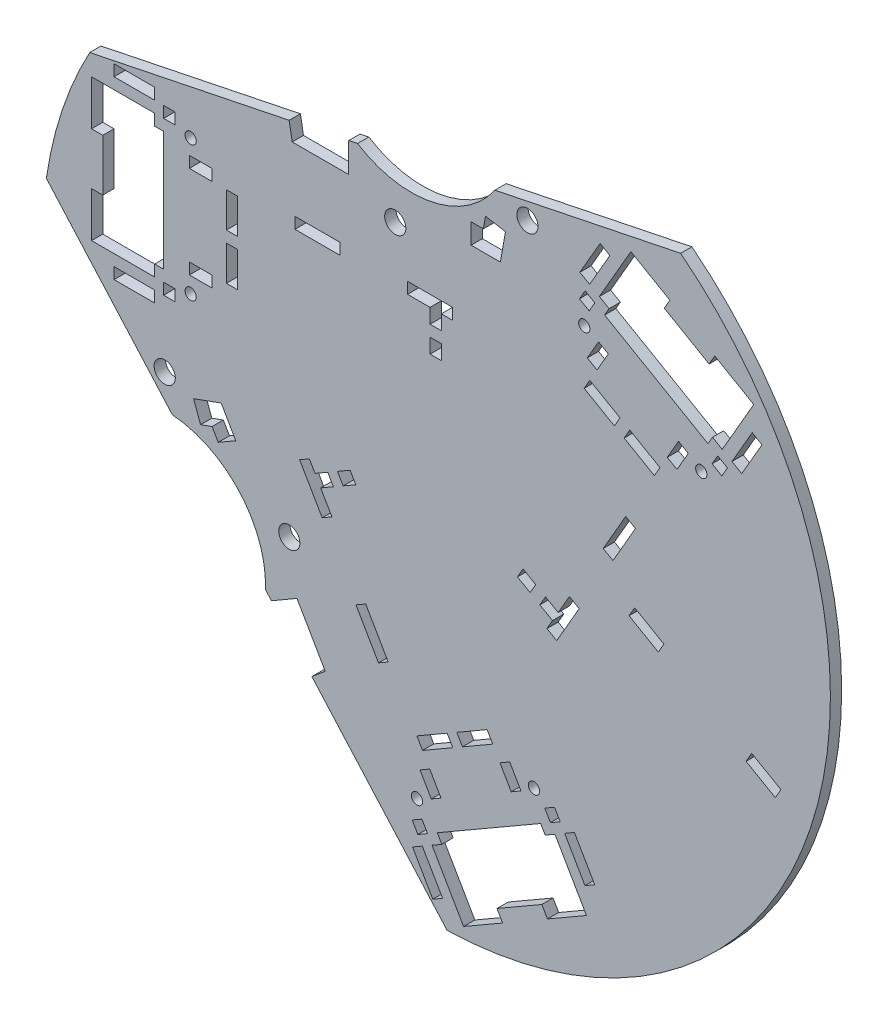
from build123d import *

# Parameters (mm, degrees)
ESQUISSE1_R             = 175
BOSS_EXTRU_1_DEPTH      = 5
ESQUISSE2_W             = 5
ESQUISSE2_H             = 6.5
ESQUISSE2_W_2           = 20
ESQUISSE2_H_2           = 5
ESQUISSE2_H_3           = 15.5
ESQUISSE2_W_3           = 10
ESQUISSE2_W_4           = 18
ESQUISSE2_H_4           = 20
ENL_V_MAT_EXTRU_1_DEPTH = 5
ENL_V_MAT_EXTRU_2_DEPTH = 5
ESQUISSE4_R             = 2.5
ENL_V_MAT_EXTRU_3_DEPTH = 5
ESQUISSE5_R             = 4.7
ENL_V_MAT_EXTRU_4_DEPTH = 5
BOSS_EXTRU_2_DEPTH      = 5
ENL_V_MAT_EXTRU_5_DEPTH = 5


with BuildPart() as part:
    # Esquisse1 → Boss.-Extru.1 (new body)
    with BuildSketch(Plane.XY):
        with Locations((148.080426897, -12.110171348)):
            Circle(ESQUISSE1_R)
    extrude(amount=BOSS_EXTRU_1_DEPTH)

    # Esquisse2 → Enlèv. mat.-Extru.1 (cut)
    with BuildSketch(Plane(origin=(0, 0, 0), x_dir=(-1, 0, 0), z_dir=(0, 0, -1))):
        Polygon((-155.311788567, 53.777441362), (-135.311788567, 53.777441362), (-135.311788567, 48.777441362), (-145.311788567, 48.777441362), (-145.311788567, 42.277441362), (-150.311788567, 42.277441362), (-150.311788567, 48.777441362), (-155.311788567, 48.777441362), align=None)
        with Locations((-147.811788567, 34.027441362)):
            Rectangle(ESQUISSE2_W, ESQUISSE2_H)
        with Locations((-95.311788567, 51.277441362)):
            Rectangle(ESQUISSE2_W_2, ESQUISSE2_H_2)
        with Locations((-57.36, 41.027441362)):
            Rectangle(ESQUISSE2_W, ESQUISSE2_H_3)
        with Locations((-57.36, 20.527441362)):
            Rectangle(ESQUISSE2_W, ESQUISSE2_H_3)
        with Locations((-43.43, 10.277441362)):
            Rectangle(ESQUISSE2_W_3, ESQUISSE2_H_2)
        with Locations((-29.5, -3.222558638)):
            Rectangle(ESQUISSE2_W, ESQUISSE2_H_2)
        with Locations((-14, -8.222558638)):
            Rectangle(ESQUISSE2_W_4, ESQUISSE2_H_2)
        with Locations((2.5, 9.277441362)):
            Rectangle(ESQUISSE2_W, ESQUISSE2_H_4)
        with Locations((2.5, 52.277441362)):
            Rectangle(ESQUISSE2_W, ESQUISSE2_H_4)
        with Locations((-14, 69.777441362)):
            Rectangle(ESQUISSE2_W_4, ESQUISSE2_H_2)
        with Locations((-29.5, 64.777441362)):
            Rectangle(ESQUISSE2_W, ESQUISSE2_H_2)
        with Locations((-43.43, 51.277441362)):
            Rectangle(ESQUISSE2_W_3, ESQUISSE2_H_2)
        Polygon((-87.404399659, -38.791434793), (-97.404399659, -56.111942869), (-101.734526678, -53.611942869), (-96.734526678, -44.951688831), (-102.363691803, -41.701688831), (-99.863691803, -37.371561812), (-94.234526678, -40.621561812), (-91.734526678, -36.291434793), align=None)
        Polygon((-104.193818822, -34.871561812), (-106.693818822, -39.201688831), (-112.322983946, -35.951688831), (-109.822983946, -31.621561812), align=None)
        Polygon((-112.404399659, -82.092704982), (-122.404399659, -99.413213058), (-126.734526678, -96.913213058), (-116.734526678, -79.592704982), align=None)
        Polygon((-139.460420962, -118.955108529), (-141.960420962, -123.285235548), (-155.38381472, -115.535235548), (-152.88381472, -111.205108529), align=None)
        Polygon((-157.213941739, -108.705108529), (-159.713941739, -113.035235548), (-173.137335498, -105.285235548), (-170.637335498, -100.955108529), align=None)
        Polygon((-176.352335498, -110.853778894), (-181.352335498, -119.514032932), (-185.682462517, -117.014032932), (-180.682462517, -108.353778894), align=None)
        Polygon((-196.258678449, -118.332576278), (-198.758678449, -122.662703297), (-203.088805468, -120.162703297), (-200.588805468, -115.832576278), align=None)
        Polygon((-205.088805468, -123.626804912), (-214.088805468, -139.215262181), (-218.418932487, -136.715262181), (-209.418932487, -121.126804912), align=None)
        Polygon((-212.258678449, -146.045389199), (-214.758678449, -150.375516218), (-197.438170373, -160.375516218), (-194.938170373, -156.045389199), align=None)
        Polygon((-175.019586086, -167.545389199), (-177.519586086, -171.875516218), (-160.199078011, -181.875516218), (-157.699078011, -177.545389199), align=None)
        Polygon((-141.868950992, -160.126804912), (-150.868950992, -175.715262181), (-146.538823973, -178.215262181), (-137.538823973, -162.626804912), align=None)
        Polygon((-139.868950992, -156.662703297), (-137.368950992, -152.332576278), (-141.699078011, -149.832576278), (-144.199078011, -154.162703297), align=None)
        Polygon((-145.845293943, -140.014032932), (-140.845293943, -131.353778894), (-145.175420962, -128.853778894), (-150.175420962, -137.514032932), align=None)
        Polygon((-201.525092463, -51.316520615), (-211.525092463, -33.996012539), (-207.194965444, -31.496012539), (-202.194965444, -40.156266577), (-196.56580032, -36.906266577), (-194.06580032, -41.236393596), (-199.694965444, -44.486393596), (-197.194965444, -48.816520615), align=None)
        Polygon((-189.735673301, -38.736393596), (-192.235673301, -34.406266577), (-186.606508176, -31.156266577), (-184.106508176, -35.486393596), align=None)
        Polygon((-226.525092463, -8.015250425), (-236.525092463, 9.30525765), (-232.194965444, 11.80525765), (-222.194965444, -5.515250425), align=None)
        Polygon((-244.920859728, 33.847153121), (-247.420859728, 38.17728014), (-233.997465969, 45.92728014), (-231.497465969, 41.597153121), align=None)
        Polygon((-227.16733895, 44.097153121), (-229.66733895, 48.42728014), (-216.243945192, 56.17728014), (-213.743945192, 51.847153121), align=None)
        Polygon((-219.458945192, 61.745823487), (-224.458945192, 70.406077524), (-220.128818173, 72.906077524), (-215.128818173, 64.245823487), align=None)
        Polygon((-215.982602241, 82.724620871), (-218.482602241, 87.05474789), (-214.152475222, 89.55474789), (-211.652475222, 85.224620871), align=None)
        Polygon((-216.152475222, 93.018849505), (-225.152475222, 108.607306773), (-220.822348203, 111.107306773), (-211.822348203, 95.518849505), align=None)
        Polygon((-231.982602241, 110.437433792), (-234.482602241, 114.767560811), (-251.803110316, 104.767560811), (-249.303110316, 100.437433792), align=None)
        Polygon((-269.221694603, 88.937433792), (-271.721694603, 93.267560811), (-289.042202679, 83.267560811), (-286.542202679, 78.937433792), align=None)
        Polygon((-279.372329698, 56.518849505), (-288.372329698, 72.107306773), (-292.702456717, 69.607306773), (-283.702456717, 54.018849505), align=None)
        Polygon((-277.372329698, 53.05474789), (-274.872329698, 48.724620871), (-270.542202679, 51.224620871), (-273.042202679, 55.55474789), align=None)
        Polygon((-259.965986747, 49.906077524), (-254.965986747, 41.245823487), (-250.635859728, 43.745823487), (-255.635859728, 52.406077524), align=None)
    extrude(amount=-ENL_V_MAT_EXTRU_1_DEPTH, mode=Mode.SUBTRACT)

    # Esquisse3 → Enlèv. mat.-Extru.2 (cut)
    with BuildSketch(Plane(origin=(0, 0, 0), x_dir=(-1, 0, 0), z_dir=(0, 0, -1))):
        Polygon((0, -0.722558638), (-23, -0.722558638), (-23, 4.277441362), (-27, 4.277441362), (-27, 57.277441362), (-23, 57.277441362), (-23, 62.277441362), (0, 62.277441362), align=None)
        Polygon((-212.258678449, -146.045389199), (-200.758678449, -126.126804912), (-196.42855143, -128.626804912), (-194.42855143, -125.162703297), (-148.52920503, -151.662703297), (-150.52920503, -155.126804912), (-146.199078011, -157.626804912), (-157.699078011, -177.545389199), align=None)
        Polygon((-231.982602241, 110.437433792), (-220.482602241, 90.518849505), (-224.81272926, 88.018849505), (-222.81272926, 84.55474789), (-268.71207566, 58.05474789), (-270.71207566, 61.518849505), (-275.042202679, 59.018849505), (-286.542202679, 78.937433792), align=None)
    extrude(amount=-ENL_V_MAT_EXTRU_2_DEPTH, mode=Mode.SUBTRACT)

    # Esquisse4 → Enlèv. mat.-Extru.3 (cut)
    with BuildSketch(Plane(origin=(0, 0, 0), x_dir=(-1, 0, 0), z_dir=(0, 0, -1))):
        with Locations((-39, 60.777441362)):
            Circle(ESQUISSE4_R)
        with Locations((-39, 0.777441362)):
            Circle(ESQUISSE4_R)
        with Locations((-139.498116116, -143.020398452)):
            Circle(ESQUISSE4_R)
        with Locations((-191.459640343, -113.020398452)):
            Circle(ESQUISSE4_R)
        with Locations((-265.743164573, 45.912443044)):
            Circle(ESQUISSE4_R)
        with Locations((-213.781640346, 75.912443044)):
            Circle(ESQUISSE4_R)
    extrude(amount=-ENL_V_MAT_EXTRU_3_DEPTH, mode=Mode.SUBTRACT)

    # Esquisse5 → Enlèv. mat.-Extru.4 (cut)
    with BuildSketch(Plane(origin=(0, 0, 0), x_dir=(-1, 0, 0), z_dir=(0, 0, -1))):
        with Locations((-188.54080573, 103.777441362)):
            Circle(ESQUISSE5_R)
        with Locations((-129.859999997, 73.777441362)):
            Circle(ESQUISSE5_R)
        with Locations((-27.488620889, -35.014261787)):
            Circle(ESQUISSE5_R)
        with Locations((-82.809785869, -70.833330267)):
            Circle(ESQUISSE5_R)
        Polygon((9.512961524, 70.443622585), (-93.474910733, 91.632672923), (-94.859999997, 83.777441362), (-174.859999997, 83.777441362), (-179.360865983, 109.303120805), (-315.699146075, 137.353789457), (-290.786999001, 258.437508623), (34.425108598, 191.527341751), align=None)
        Polygon((-233.671367804, -25.637538451), (-246.66174886, -33.137538451), (-249.16174886, -28.807411432), (-236.171367804, -21.307411432), align=None)
        Polygon((-155.383438382, -189.866946156), (-85.539246378, -111.271357669), (-91.649531831, -106.144219399), (-51.649531831, -36.862187096), (-27.293211991, -45.727162534), (65.168519701, 58.319917207), (157.574022946, -23.796494605), (-62.977935137, -271.983357968), align=None)
        Polygon((-285.632892031, -55.637538451), (-298.623273088, -63.137538451), (-301.123273088, -58.807411432), (-288.132892031, -51.307411432), align=None)
    extrude(amount=-ENL_V_MAT_EXTRU_4_DEPTH, mode=Mode.SUBTRACT)

    # Esquisse6 → Boss.-Extru.2 (add)
    with BuildSketch(Plane(origin=(0, 0, 0), x_dir=(-1, 0, 0), z_dir=(0, 0, -1))):
        with BuildLine():
            Line((-72.219328665, -96.282469671), (-85.539246378, -111.271357669))
            Line((-85.539246378, -111.271357669), (-94.478128434, -107.364683264))
            Line((-94.478128434, -107.364683264), (-52.020767653, -31.413182311))
            Line((-52.020767653, -31.413182311), (-27.293211991, -45.727162534))
            Line((-27.293211991, -45.727162534), (-30.866030993, -49.747651624))
            ThreePointArc((-30.866030993, -49.747651624), (-60.888072009, -64.710251454), (-72.219328665, -96.282469671))
        make_face()
        with BuildLine():
            Line((-113.11562737, 95.67361604), (-93.474910733, 91.632672923))
            Line((-93.474910733, 91.632672923), (-92.388748984, 81.938036779))
            Line((-92.388748984, 81.938036779), (-179.393358655, 80.731439317))
            Line((-179.393358655, 80.731439317), (-179.360865983, 109.303120805))
            Line((-179.360865983, 109.303120805), (-174.092610795, 108.219213332))
            ThreePointArc((-174.092610795, 108.219213332), (-146.123598727, 89.700663053), (-113.11562737, 95.67361604))
        make_face()
    extrude(amount=-BOSS_EXTRU_2_DEPTH)

    # Esquisse7 → Enlèv. mat.-Extru.5 (cut)
    with BuildSketch(Plane(origin=(0, 0, 0), x_dir=(-1, 0, 0), z_dir=(0, 0, -1))):
        Polygon((-109.197691521, 94.867527535), (-109.197691521, 81.777441362), (-84.10034763, 81.777441362), (-82.751624535, 89.426430129), align=None)
        Polygon((-74.876389713, -99.272457394), (-86.212736876, -92.727414308), (-98.761408822, -114.462351685), (-92.811551784, -119.454874531), align=None)
        Polygon((-163.538199262, 81.777441362), (-176.538199262, 81.777441362), (-178.795625572, 94.579942151), (-169.932355795, 96.14277575), (-168.986302582, 90.777441362), (-163.538199262, 90.777441362), align=None)
        Polygon((-59.042483006, -45.667154149), (-52.542483006, -34.4088239), (-40.326478935, -38.855085763), (-43.404660225, -47.31231935), (-48.524202712, -45.448958272), (-51.248254372, -50.167154149), align=None)
    extrude(amount=-ENL_V_MAT_EXTRU_5_DEPTH, mode=Mode.SUBTRACT)


solid = part.part
